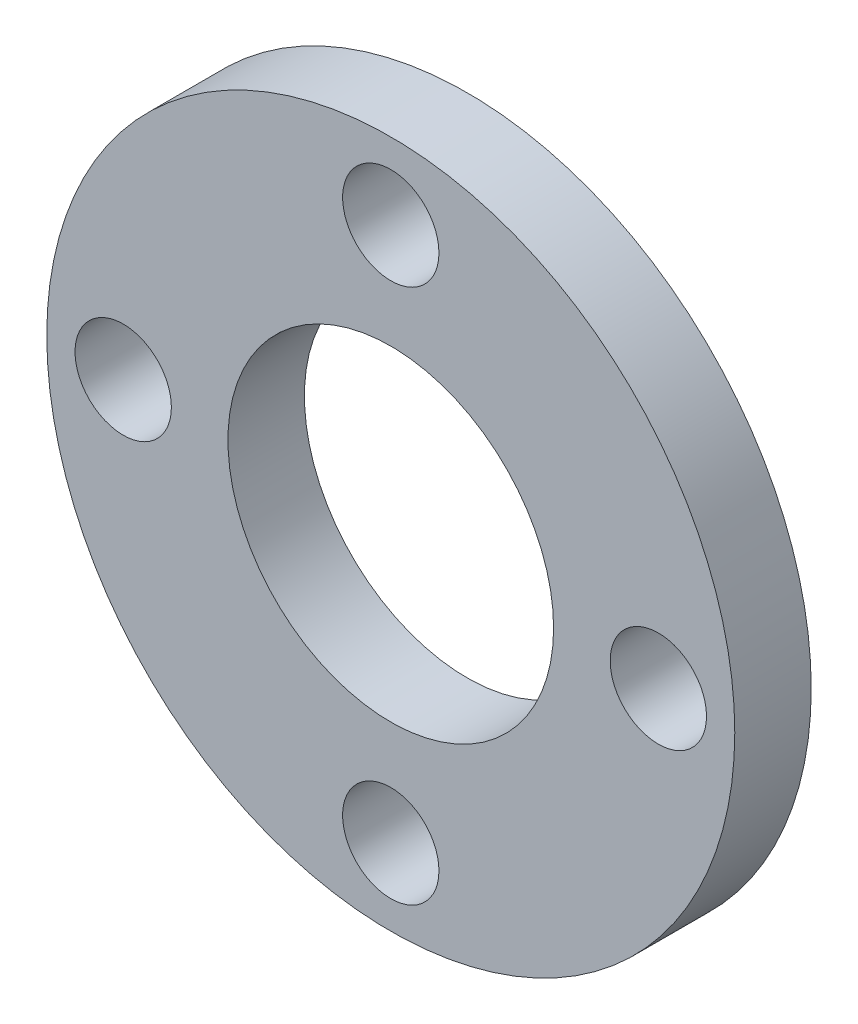
from build123d import *

# Parameters (mm, degrees)
SZKIC1_R                    = 45
SZKIC1_R_2                  = 6.3
SZKIC1_R_3                  = 21.3
DODANIE_WYCI_GNI_CIE3_DEPTH = 10


with BuildPart() as part:
    # Szkic1 → Dodanie-wyciągnięcie3 (new body)
    with BuildSketch(Plane.XY):
        Circle(SZKIC1_R)
        with Locations((0, -35)):
            Circle(SZKIC1_R_2, mode=Mode.SUBTRACT)
        with Locations((-35, 0)):
            Circle(SZKIC1_R_2, mode=Mode.SUBTRACT)
        Circle(SZKIC1_R_3, mode=Mode.SUBTRACT)
        with Locations((35, 0)):
            Circle(SZKIC1_R_2, mode=Mode.SUBTRACT)
        with Locations((0, 35)):
            Circle(SZKIC1_R_2, mode=Mode.SUBTRACT)
    extrude(amount=DODANIE_WYCI_GNI_CIE3_DEPTH)


solid = part.part
